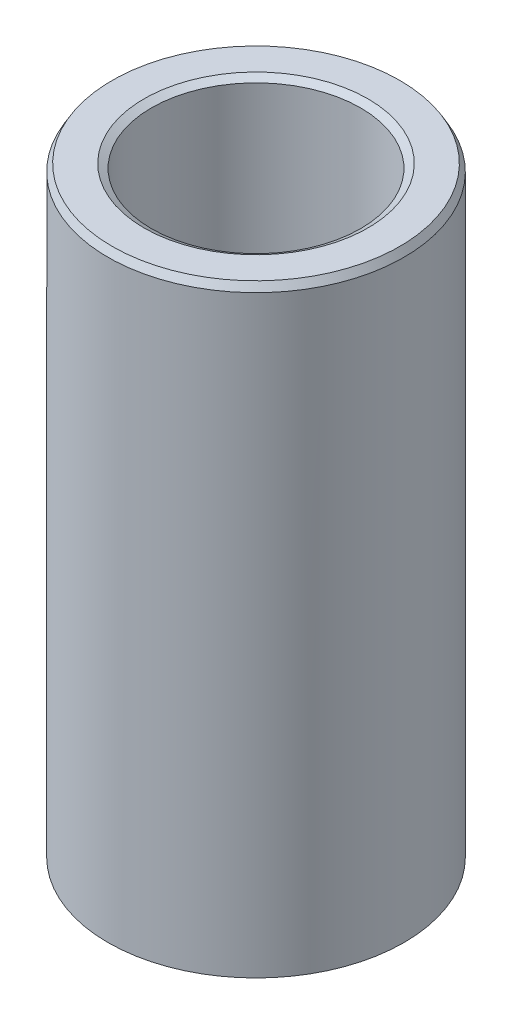
from build123d import *
from OCP.BRepFilletAPI import BRepFilletAPI_MakeChamfer

# Parameters (mm, degrees)
SKETCH1_R           = 57.5
BOSS_EXTRUDE1_DEPTH = 235.009031368
SKETCH2_R           = 40.641039489
CUT_EXTRUDE1_DEPTH  = 249.680004875
CHAMFER1_SIZE       = 2.838350949
CHAMFER1_SIZE2      = 1.638722684


with BuildPart() as part:
    # Sketch1 → Boss-Extrude1 (new body)
    with BuildSketch(Plane(origin=(0, 0, 0), x_dir=(1, 0, 0), z_dir=(0, 1, 0))):
        Circle(SKETCH1_R)
    extrude(amount=BOSS_EXTRUDE1_DEPTH)

    # Sketch2 → Cut-Extrude1 (cut, through all)
    with BuildSketch(Plane(origin=(0, 0, 0), x_dir=(1, 0, 0), z_dir=(0, 1, 0))):
        Circle(SKETCH2_R)
    extrude(amount=CUT_EXTRUDE1_DEPTH, mode=Mode.SUBTRACT)

    # Chamfer1: one chamfer whose edges measure the first distance from different faces: ONE call of the kernel's chamfer builder (chamfer() names one face for all edges)
    chamfer1_edges_1 = [part.edges().sort_by_distance(p)[0] for p in [
        (-40.641039489, 235.009031368, 0),
    ]]
    chamfer1_side_1 = [part.faces().sort_by_distance(p)[0] for p in [
        (-55.873654403, 235.009031368, 0),
    ]]
    chamfer1_edges_2 = [part.edges().sort_by_distance(p)[0] for p in [
        (-40.641039489, 0, 0),
    ]]
    chamfer1_side_2 = [part.faces().sort_by_distance(p)[0] for p in [
        (-40.641039489, 117.504515684, 0),
    ]]
    chamfer1_edges_3 = [part.edges().sort_by_distance(p)[0] for p in [
        (-57.5, 0, 0),
    ]]
    chamfer1_side_3 = [part.faces().sort_by_distance(p)[0] for p in [
        (-55.873654403, 0, 0),
    ]]
    chamfer1_edges_4 = [part.edges().sort_by_distance(p)[0] for p in [
        (-57.5, 235.009031368, 0),
    ]]
    chamfer1_side_4 = [part.faces().sort_by_distance(p)[0] for p in [
        (-57.5, 117.504515684, 0),
    ]]
    chamfer1 = BRepFilletAPI_MakeChamfer(part.part.solid().wrapped)
    for e in chamfer1_edges_1:
        chamfer1.Add(CHAMFER1_SIZE, CHAMFER1_SIZE2, e.wrapped, chamfer1_side_1[0].wrapped)  # the first distance lies on this face
    for e in chamfer1_edges_2:
        chamfer1.Add(CHAMFER1_SIZE, CHAMFER1_SIZE2, e.wrapped, chamfer1_side_2[0].wrapped)  # the first distance lies on this face
    for e in chamfer1_edges_3:
        chamfer1.Add(CHAMFER1_SIZE, CHAMFER1_SIZE2, e.wrapped, chamfer1_side_3[0].wrapped)  # the first distance lies on this face
    for e in chamfer1_edges_4:
        chamfer1.Add(CHAMFER1_SIZE, CHAMFER1_SIZE2, e.wrapped, chamfer1_side_4[0].wrapped)  # the first distance lies on this face
    add(Compound.cast(chamfer1.Shape()), mode=Mode.REPLACE)


solid = part.part
